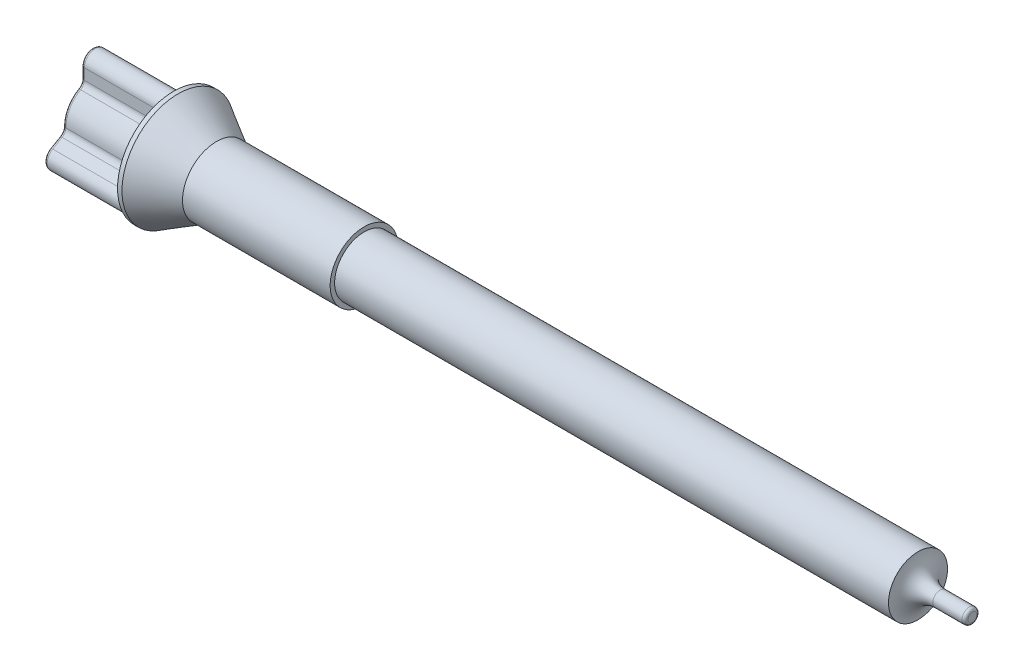
from build123d import *

# Parameters (mm, degrees)
BOSS_EXTRUDE1_DEPTH = 2.75
CIRPATTERN1_COUNT   = 3
FILLET1_R           = 0.25
SKETCH3_R           = 0.25
BOSS_EXTRUDE2_DEPTH = 1.84
FILLET2_R           = 0.75
FILLET3_R           = 0.1


with BuildPart() as part:
    # Sketch1 → Revolve1 (revolve)
    with BuildSketch(Plane.XY, mode=Mode.PRIVATE) as revolve1_sk:
        Polygon((0, 0), (0, 1), (2.75, 1), (2.75, 1.9), (2.9, 1.9), (4.199038106, 1.15), (9.199038106, 1.15), (9.199038106, 1), (27.949038106, 1), (27.949038106, 0), align=None)
    revolve(revolve1_sk.sketch.rotate(Axis((27.949038106, 0, 0), (-1, 0, 0)), 90), axis=Axis((27.949038106, 0, 0), (-1, 0, 0)))

    # Sketch2 → Boss-Extrude1 (add)
    with BuildSketch(Plane.ZY):
        with BuildLine():
            Line((-0.375, 0), (0.375, 0))
            Line((0.375, 0), (0.375, 1.45))
            ThreePointArc((0.375, 1.45), (0, 1.825), (-0.375, 1.45))
            Line((-0.375, 1.45), (-0.375, 0))
        make_face()
    boss_extrude1 = extrude(amount=-BOSS_EXTRUDE1_DEPTH)

    # CirPattern1: Boss-Extrude1 ×3 about axis
    cirpattern1_axis = Axis((0, 0, 0), (1, 0, 0))
    for i in range(1, CIRPATTERN1_COUNT):
        add(boss_extrude1.rotate(cirpattern1_axis, i * 360 / CIRPATTERN1_COUNT))

    # Fillet1
    fillet1_edges = [part.edges().sort_by_distance(p)[0] for p in [
        (2.75, 0.5, 0.866025404),
        (1.375, 0.927024811, -0.375),
        (1.375, 0.927024811, 0.375),
        (2.75, -1, 0),
        (2.75, 0.5, -0.866025404),
        (1.375, -0.138752879, 0.990327036),
        (1.375, -0.788271932, 0.615327036),
        (1.375, -0.788271932, -0.615327036),
        (1.375, -0.138752879, -0.990327036),
    ]]
    fillet(fillet1_edges, radius=FILLET1_R)

    # Sketch3 → Boss-Extrude2 (add)
    with BuildSketch(Plane(origin=(27.949038106, 0, 0), x_dir=(0, 0, -1), z_dir=(1, 0, 0))):
        Circle(SKETCH3_R)
    extrude(amount=BOSS_EXTRUDE2_DEPTH)

    # Fillet2
    fillet2_edges = [part.edges().sort_by_distance(p)[0] for p in [
        (27.949038106, 0, 0.25),
    ]]
    fillet(fillet2_edges, radius=FILLET2_R - 0.0001)  # a hair under: the kernel refuses the full size

    # Fillet3
    fillet3_edges = [part.edges().sort_by_distance(p)[0] for p in [
        (29.789038106, 0, 0.25),
        (0, 1.825, 0),
        (0, 1.266265877, -0.375),
        (0, -0.9125, -1.580496362),
        (0, -0.957892465, -0.909118418),
        (0, -0.9125, 1.580496362),
        (0, -0.308373412, 1.284118418),
        (0, 0.4999999999999994, -0.866025403784439),
        (0, -0.308373412, -1.284118418),
        (0, -0.957892465, 0.909118418),
        (0, -1, 0),
        (0, 0.5000000000000002, 0.8660254037844385),
        (0, 1.266265877, 0.375),
        (0, 0.957531755, -0.408493649),
        (0, -0.125, -1.033493649),
        (0, -0.832531755, 0.625),
        (0, -0.832531755, -0.625),
        (0, -0.125, 1.033493649),
        (0, 0.957531755, 0.408493649),
    ]]
    fillet(fillet3_edges, radius=FILLET3_R)


solid = part.part
